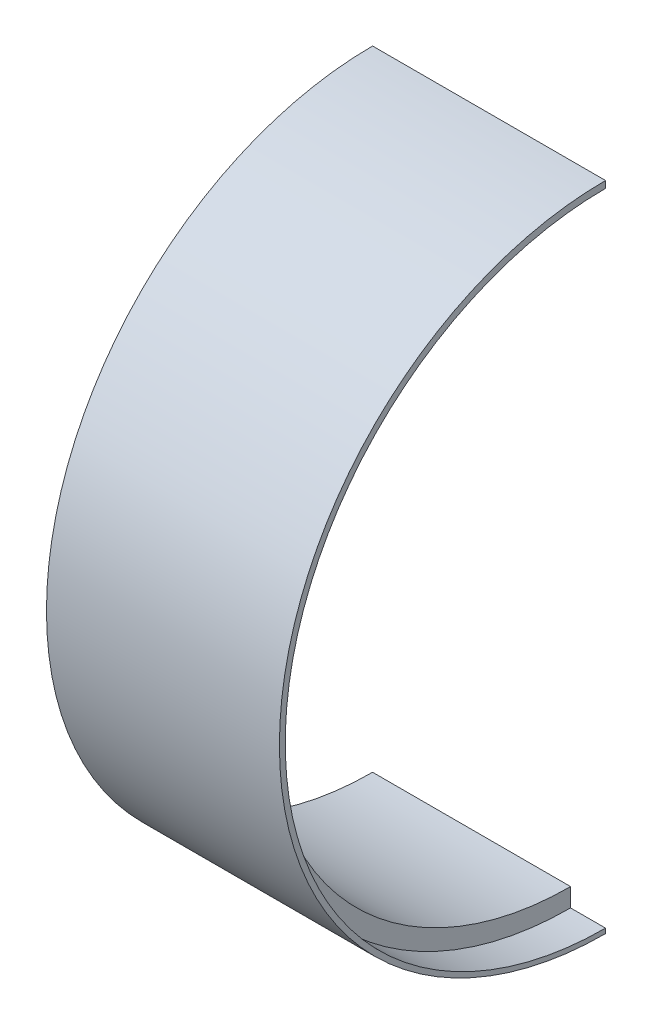
from build123d import *

# Parameters (mm, degrees)
BOSS_EXTRUDE1_DEPTH = 508
CAVITY1_START       = 431.8
CAVITY1_DEPTH       = 76.2


# Read off the part's stored shape, not the designer's step: Cavity1
with BuildPart() as part:
    # Sketch1 → Boss-Extrude1 (new body)
    with BuildSketch(Plane(origin=(0, 0, 0), x_dir=(0, 0, -1), z_dir=(1, 0, 0))):
        with BuildLine():
            Line((0, 711.2), (0, 660.4))
            ThreePointArc((0, 660.4), (-660.4, 0), (0, -660.4))
            Line((0, -660.4), (0, -711.2))
            ThreePointArc((0, -711.2), (-711.2, 0), (0, 711.2))
        make_face()
    extrude(amount=BOSS_EXTRUDE1_DEPTH)

    # Cavity1 outline → Cavity1 (cut)
    with BuildSketch(Plane.YZ.offset(CAVITY1_START)):
        with BuildLine():
            ThreePointArc((696.250142702, 0), (-2.249857298, 698.5), (-700.749857298, 0))
            Line((-700.749857298, 0), (-660.4, 0))
            ThreePointArc((-660.4, 0), (0, 660.4), (660.4, 0))
            Line((660.4, 0), (696.250142702, 0))
        make_face()
    extrude(amount=CAVITY1_DEPTH, mode=Mode.SUBTRACT)


solid = part.part
